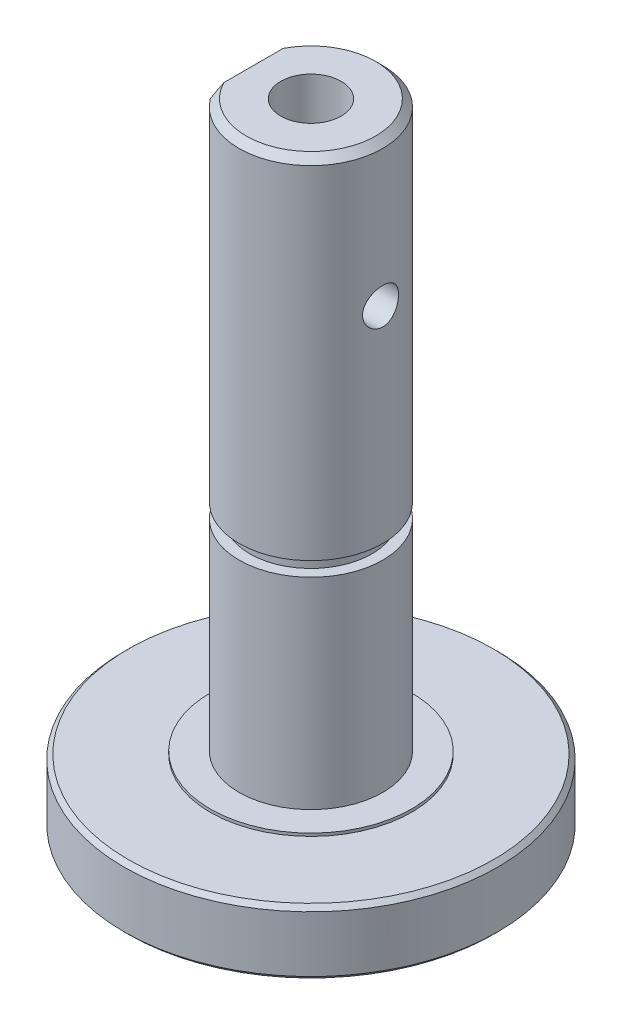
from build123d import *

# Parameters (mm, degrees)
CUT_EXTRUDE_START           = -20
CUT_EXTRUDE_1_DEPTH         = 20
HOLE_WIZARD_4_2_4_2_1_D     = 4.2
HOLE_WIZARD_4_2_4_2_1_DEPTH = 14
HOLE_WIZARD_4_2_4_2_1_TIP   = 1.2618073
HOLE_WIZARD_2_5_2_5_1_D     = 2.5
HOLE_WIZARD_2_5_2_5_1_DEPTH = 12.312546285
CHAMFER_1_SIZE              = 0.3
CHAMFER_2_SIZE              = 0.5


with BuildPart() as part:
    # 草图1 → 旋转1 (revolve)
    with BuildSketch(Plane(origin=(0, 0, 0), x_dir=(-1, 0, 0), z_dir=(0, 0, -1))):
        Polygon((-13, 0), (0, 0), (0, 44), (-5, 44), (-5, 19.7), (-4.25, 19.7), (-4.25, 18.7), (-5, 18.7), (-5, 4.7), (-7, 4.7), (-7, 4.5), (-13, 4.5), align=None)
    revolve(axis=Axis((0, 0, 0), (0, 1, 0)))

    # 草图2 → 切除-拉伸1 (cut)
    with BuildSketch(Plane(origin=(0, 44, 0), x_dir=(-1, 0, 0), z_dir=(0, 1, 0)).offset(CUT_EXTRUDE_START)):
        with BuildLine():
            Line((4, 3), (4, -3))
            ThreePointArc((4, -3), (5, 0), (4, 3))
        make_face()
    extrude(amount=CUT_EXTRUDE_1_DEPTH, mode=Mode.SUBTRACT)

    # Ø4.2 (4.2) 直径孔1
    with Locations(Plane(origin=(0, 44, 0), x_dir=(1, 0, 0), z_dir=(0, 1, 0))):
        with Locations((0, 0)):
            Hole(HOLE_WIZARD_4_2_4_2_1_D / 2, depth=HOLE_WIZARD_4_2_4_2_1_DEPTH)
            with Locations((0, 0, -(HOLE_WIZARD_4_2_4_2_1_DEPTH + HOLE_WIZARD_4_2_4_2_1_TIP / 2))):  # 118° drill point
                Cone(0, HOLE_WIZARD_4_2_4_2_1_D / 2, HOLE_WIZARD_4_2_4_2_1_TIP, mode=Mode.SUBTRACT)

    # Ø2.5 (2.5) 直径孔1
    with Locations(Plane.ZY.offset(4)):
        with Locations((0, 34)):
            Hole(HOLE_WIZARD_2_5_2_5_1_D / 2, depth=HOLE_WIZARD_2_5_2_5_1_DEPTH)

    # 倒角1
    chamfer_1_edges = [part.edges().sort_by_distance(p)[0] for p in [
        (-13, 4.5, 0),
        (-13, 0, 0),
    ]]
    chamfer(chamfer_1_edges, length=CHAMFER_1_SIZE)

    # 倒角2
    chamfer_2_edges = [part.edges().sort_by_distance(p)[0] for p in [
        (1.58113883, 44, 4.74341649),
    ]]
    chamfer(chamfer_2_edges, length=CHAMFER_2_SIZE)


solid = part.part
